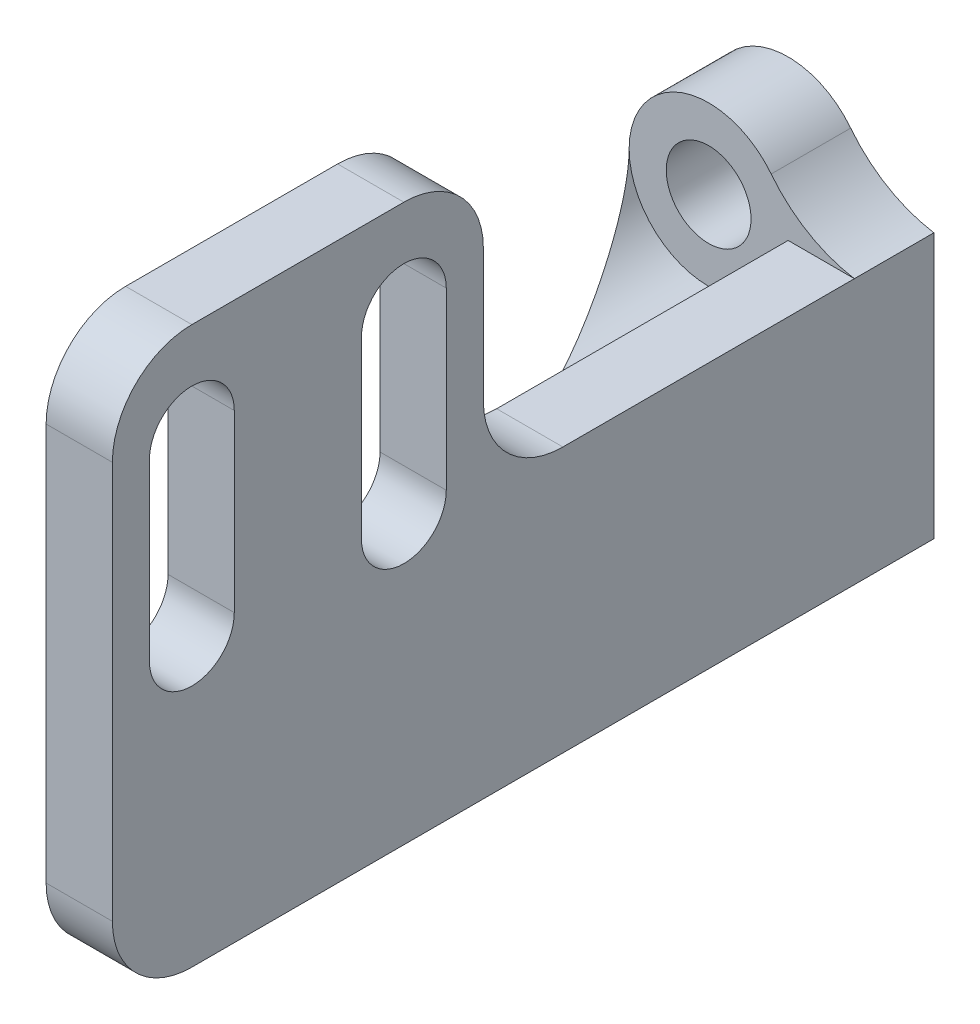
from build123d import *

# Parameters (mm, degrees)
SKETCH_1_R          = 1.6
EXTRUDE_1_DEPTH     = 3
SKETCH_3_W          = 2.5
SKETCH_3_H          = 10
EXTRUDE_2_DEPTH     = 28
FILLET_1_R          = 5
FILLET_2_R          = 5
SKETCH_4_W          = 14
SKETCH_4_H          = 11
EXTRUDE_3_DEPTH     = 2.5
CUT_EXTRUDE_1_DEPTH = 57.126655481
EXTRUDE_4_DEPTH     = 10
SKETCH_8_R          = 3
CUT_EXTRUDE_2_DEPTH = 55.140571252
FILLET_3_R          = 3


with BuildPart() as part:
    # 草图1 → 凸台-拉伸1 (new body)
    with BuildSketch(Plane.XY):
        with BuildLine():
            ThreePointArc((3, -33.010340746), (0, -30.010340746), (-3, -33.010340746))
            Line((-3, -33.010340746), (-3, -43.010340746))
            ThreePointArc((-3, -43.010340746), (0, -46.010340746), (3, -43.010340746))
            Line((3, -43.010340746), (5.5, -43.010340746))
            Line((5.5, -43.010340746), (5.5, -33.010340746))
            Line((5.5, -33.010340746), (3, -33.010340746))
        make_face()
        with Locations((0, -33.010340746)):
            Circle(SKETCH_1_R, mode=Mode.SUBTRACT)
        with Locations((0, -43.010340746)):
            Circle(SKETCH_1_R, mode=Mode.SUBTRACT)
    extrude(amount=EXTRUDE_1_DEPTH)

    # 草图3 → 凸台-拉伸2 (add)
    with BuildSketch(Plane.XY.offset(3)):
        with Locations((4.25, -38.010340746)):
            Rectangle(SKETCH_3_W, SKETCH_3_H)
    extrude(amount=EXTRUDE_2_DEPTH)

    # 圆角1
    # the kernel refuses this fillet: 5 mm, written as the material it adds along each edge
    with BuildSketch(Plane(origin=(3, -43.010340746, 0), x_dir=(-0.32639560491693326, -0.9452332564456825, 0), z_dir=(0, 0, 1))) as fillet_1_piece_1:
        with BuildLine():
            CenterArc((3.590351654, 4.726166282), FILLET_1_R, 208.20428203, 42.745569225)
            Line((-0.815989012, 2.363083141), (0, 0))
            ThreePointArc((0, 0), (0.979186815, 0.164300231), (1.95837363, 0))
        make_face()
    extrude(amount=3)

    # 圆角2
    # the kernel refuses this fillet: 5 mm, written as the material it adds along each edge
    with BuildSketch(Plane(origin=(3, -33.010340746, 0), x_dir=(1, 0, 0), z_dir=(0, 0, 1))) as fillet_2_piece_1:
        with BuildLine():
            CenterArc((3.295454545, 4.936319688), FILLET_2_R, 218.100297491, 42.745569225)
            ThreePointArc((-0.639204545, 1.851119883), (-0.164300231, 0.979186815), (0, 0))
            Line((0, 0), (2.5, 0))
        make_face()
    extrude(amount=3)

    # 草图4 → 凸台-拉伸3 (add)
    with BuildSketch(Plane(origin=(5.5, 0, 0), x_dir=(0, 0, -1), z_dir=(1, 0, 0))):
        with Locations((-24, -27.510340746)):
            Rectangle(SKETCH_4_W, SKETCH_4_H)
    extrude(amount=-EXTRUDE_3_DEPTH)

    # 草图5 → 切除-拉伸1 (cut, through all)
    with BuildSketch(Plane(origin=(5.5, 0, 0), x_dir=(0, 0, -1), z_dir=(1, 0, 0))):
        with BuildLine():
            Line((-26.4, -25.617918523), (-26.4, -32.223242404))
            ThreePointArc((-26.4, -32.223242404), (-28, -33.823242404), (-29.6, -32.223242404))
            Line((-29.6, -32.223242404), (-29.6, -25.617918523))
            ThreePointArc((-29.6, -25.617918523), (-28, -24.017918523), (-26.4, -25.617918523))
        make_face()
        with BuildLine():
            Line((-21.6, -25.617918523), (-21.6, -32.223242404))
            ThreePointArc((-21.6, -32.223242404), (-20, -33.823242404), (-18.4, -32.223242404))
            Line((-18.4, -32.223242404), (-18.4, -25.617918523))
            ThreePointArc((-18.4, -25.617918523), (-20, -24.017918523), (-21.6, -25.617918523))
        make_face()
    extrude(amount=-CUT_EXTRUDE_1_DEPTH, mode=Mode.SUBTRACT)

    # 草图6 → 凸台-拉伸4 (add)
    with BuildSketch(Plane.XZ.offset(43.010340746)):
        Polygon((3, 14), (-3, 3), (3, 3), align=None)
    extrude(amount=-EXTRUDE_4_DEPTH)

    # 草图8 → 切除-拉伸2 (cut, through all)
    with BuildSketch(Plane.XY.offset(3)):
        with Locations((0, -43.010340746)):
            Circle(SKETCH_8_R)
        with Locations((0, -33.010340746)):
            Circle(SKETCH_8_R)
    extrude(amount=CUT_EXTRUDE_2_DEPTH, mode=Mode.SUBTRACT)

    # 圆角3
    fillet_3_edges = [part.edges().sort_by_distance(p)[0] for p in [
        (4.25, -43.010340746, 31),
        (4.25, -33.010340746, 17),
        (4.25, -22.010340746, 31),
        (4.25, -22.010340746, 17),
    ]]
    fillet(fillet_3_edges, radius=FILLET_3_R)


solid = part.part
